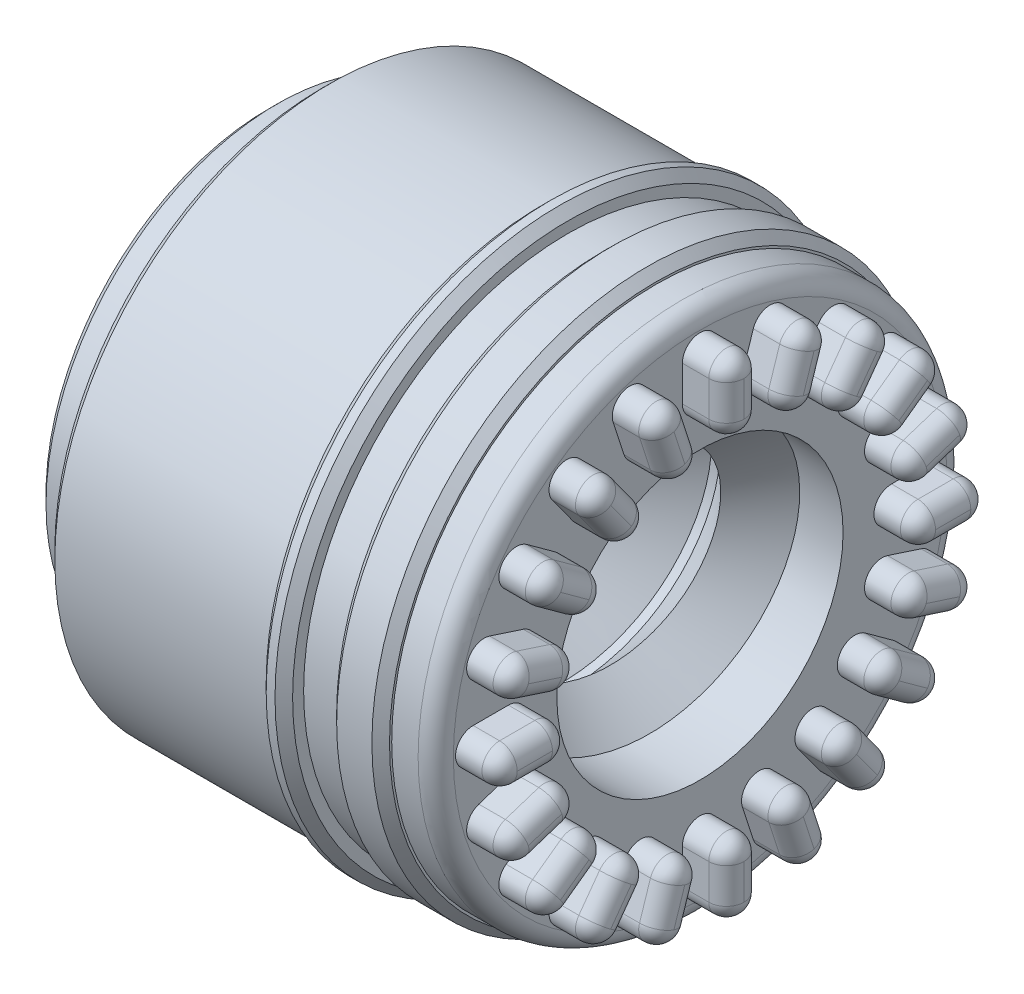
from build123d import *

# Parameters (mm, degrees)
EXTRUDE_1_DEPTH     = 1
FILLET_1_R          = 0.4
SKETCH_4_R          = 3.25
CUT_EXTRUDE_1_DEPTH = 6
FILLET_2_R          = 0.4
SWEEP_1_PITCH       = 2
SKETCH_5_R          = 0.8
SKETCH_5_R_2        = 1
CUT_EXTRUDE_2_DEPTH = 3.6
CHAMFER_1_SIZE      = 0.2
CHAMFER_2_SIZE      = 0.8


with BuildPart() as part:
    # 草图1 → 旋转1 (revolve)
    with BuildSketch(Plane.XY, mode=Mode.PRIVATE) as revolve_1_sk:
        Polygon((0, 0), (8.6, 0), (8.6, 6), (7.6, 6), (7.6, 6.25), (6.4, 6.25), (6.4, 6), (5.6, 6), (5.6, 6.45), (5.2, 6.45), (5.2, 6.25), (0, 6.25), (0, 5.25), (-1.2, 5.25), (-1.2, 2.6), (0, 2.6), align=None)
    revolve(revolve_1_sk.sketch.rotate(Axis((-19.680973305, 0, 0), (1, 0, 0)), 90), axis=Axis((-19.680973305, 0, 0), (1, 0, 0)))

    # 草图3 → 凸台-拉伸1 (add)
    with BuildSketch(Plane(origin=(8.6, 0, 0), x_dir=(0, 0, -1), z_dir=(1, 0, 0))):
        with BuildLine():
            Line((0.4, 5.15), (0.4, 4.35))
            ThreePointArc((0.4, 4.35), (0, 3.95), (-0.4, 4.35))
            Line((-0.4, 4.35), (-0.4, 5.15))
            ThreePointArc((-0.4, 5.15), (0, 5.55), (0.4, 5.15))
        make_face()
        with BuildLine():
            Line((1.971860128, 4.774334261), (1.724646532, 4.013489048))
            ThreePointArc((1.724646532, 4.013489048), (1.220617128, 3.756673239), (0.963801319, 4.260702644))
            Line((0.963801319, 4.260702644), (1.211014915, 5.021547857))
            ThreePointArc((1.211014915, 5.021547857), (1.715044319, 5.278363665), (1.971860128, 4.774334261))
        make_face()
        with BuildLine():
            Line((3.350700847, 3.93132342), (2.880472645, 3.284109825))
            ThreePointArc((2.880472645, 3.284109825), (2.321751747, 3.195617128), (2.23325905, 3.754338026))
            Line((2.23325905, 3.754338026), (2.703487252, 4.401551622))
            ThreePointArc((2.703487252, 4.401551622), (3.26220815, 4.490044319), (3.350700847, 3.93132342))
        make_face()
        with BuildLine():
            Line((4.401551622, 2.703487252), (3.754338026, 2.23325905))
            ThreePointArc((3.754338026, 2.23325905), (3.195617128, 2.321751747), (3.284109825, 2.880472645))
            Line((3.284109825, 2.880472645), (3.93132342, 3.350700847))
            ThreePointArc((3.93132342, 3.350700847), (4.490044319, 3.26220815), (4.401551622, 2.703487252))
        make_face()
        with BuildLine():
            Line((5.021547857, 1.211014915), (4.260702644, 0.963801319))
            ThreePointArc((4.260702644, 0.963801319), (3.756673239, 1.220617128), (4.013489048, 1.724646532))
            Line((4.013489048, 1.724646532), (4.774334261, 1.971860128))
            ThreePointArc((4.774334261, 1.971860128), (5.278363665, 1.715044319), (5.021547857, 1.211014915))
        make_face()
        with BuildLine():
            Line((5.15, -0.4), (4.35, -0.4))
            ThreePointArc((4.35, -0.4), (3.95, 0), (4.35, 0.4))
            Line((4.35, 0.4), (5.15, 0.4))
            ThreePointArc((5.15, 0.4), (5.55, 0), (5.15, -0.4))
        make_face()
        with BuildLine():
            Line((4.774334261, -1.971860128), (4.013489048, -1.724646532))
            ThreePointArc((4.013489048, -1.724646532), (3.756673239, -1.220617128), (4.260702644, -0.963801319))
            Line((4.260702644, -0.963801319), (5.021547857, -1.211014915))
            ThreePointArc((5.021547857, -1.211014915), (5.278363665, -1.715044319), (4.774334261, -1.971860128))
        make_face()
        with BuildLine():
            Line((3.93132342, -3.350700847), (3.284109825, -2.880472645))
            ThreePointArc((3.284109825, -2.880472645), (3.195617128, -2.321751747), (3.754338026, -2.23325905))
            Line((3.754338026, -2.23325905), (4.401551622, -2.703487252))
            ThreePointArc((4.401551622, -2.703487252), (4.490044319, -3.26220815), (3.93132342, -3.350700847))
        make_face()
        with BuildLine():
            Line((2.703487252, -4.401551622), (2.23325905, -3.754338026))
            ThreePointArc((2.23325905, -3.754338026), (2.321751747, -3.195617128), (2.880472645, -3.284109825))
            Line((2.880472645, -3.284109825), (3.350700847, -3.93132342))
            ThreePointArc((3.350700847, -3.93132342), (3.26220815, -4.490044319), (2.703487252, -4.401551622))
        make_face()
        with BuildLine():
            Line((1.211014915, -5.021547857), (0.963801319, -4.260702644))
            ThreePointArc((0.963801319, -4.260702644), (1.220617128, -3.756673239), (1.724646532, -4.013489048))
            Line((1.724646532, -4.013489048), (1.971860128, -4.774334261))
            ThreePointArc((1.971860128, -4.774334261), (1.715044319, -5.278363665), (1.211014915, -5.021547857))
        make_face()
        with BuildLine():
            Line((-0.4, -5.15), (-0.4, -4.35))
            ThreePointArc((-0.4, -4.35), (0, -3.95), (0.4, -4.35))
            Line((0.4, -4.35), (0.4, -5.15))
            ThreePointArc((0.4, -5.15), (0, -5.55), (-0.4, -5.15))
        make_face()
        with BuildLine():
            Line((-1.971860128, -4.774334261), (-1.724646532, -4.013489048))
            ThreePointArc((-1.724646532, -4.013489048), (-1.220617128, -3.756673239), (-0.963801319, -4.260702644))
            Line((-0.963801319, -4.260702644), (-1.211014915, -5.021547857))
            ThreePointArc((-1.211014915, -5.021547857), (-1.715044319, -5.278363665), (-1.971860128, -4.774334261))
        make_face()
        with BuildLine():
            Line((-3.350700847, -3.93132342), (-2.880472645, -3.284109825))
            ThreePointArc((-2.880472645, -3.284109825), (-2.321751747, -3.195617128), (-2.23325905, -3.754338026))
            Line((-2.23325905, -3.754338026), (-2.703487252, -4.401551622))
            ThreePointArc((-2.703487252, -4.401551622), (-3.26220815, -4.490044319), (-3.350700847, -3.93132342))
        make_face()
        with BuildLine():
            Line((-4.401551622, -2.703487252), (-3.754338026, -2.23325905))
            ThreePointArc((-3.754338026, -2.23325905), (-3.195617128, -2.321751747), (-3.284109825, -2.880472645))
            Line((-3.284109825, -2.880472645), (-3.93132342, -3.350700847))
            ThreePointArc((-3.93132342, -3.350700847), (-4.490044319, -3.26220815), (-4.401551622, -2.703487252))
        make_face()
        with BuildLine():
            Line((-5.021547857, -1.211014915), (-4.260702644, -0.963801319))
            ThreePointArc((-4.260702644, -0.963801319), (-3.756673239, -1.220617128), (-4.013489048, -1.724646532))
            Line((-4.013489048, -1.724646532), (-4.774334261, -1.971860128))
            ThreePointArc((-4.774334261, -1.971860128), (-5.278363665, -1.715044319), (-5.021547857, -1.211014915))
        make_face()
        with BuildLine():
            Line((-5.15, 0.4), (-4.35, 0.4))
            ThreePointArc((-4.35, 0.4), (-3.95, 0), (-4.35, -0.4))
            Line((-4.35, -0.4), (-5.15, -0.4))
            ThreePointArc((-5.15, -0.4), (-5.55, 0), (-5.15, 0.4))
        make_face()
        with BuildLine():
            Line((-4.774334261, 1.971860128), (-4.013489048, 1.724646532))
            ThreePointArc((-4.013489048, 1.724646532), (-3.756673239, 1.220617128), (-4.260702644, 0.963801319))
            Line((-4.260702644, 0.963801319), (-5.021547857, 1.211014915))
            ThreePointArc((-5.021547857, 1.211014915), (-5.278363665, 1.715044319), (-4.774334261, 1.971860128))
        make_face()
        with BuildLine():
            Line((-3.93132342, 3.350700847), (-3.284109825, 2.880472645))
            ThreePointArc((-3.284109825, 2.880472645), (-3.195617128, 2.321751747), (-3.754338026, 2.23325905))
            Line((-3.754338026, 2.23325905), (-4.401551622, 2.703487252))
            ThreePointArc((-4.401551622, 2.703487252), (-4.490044319, 3.26220815), (-3.93132342, 3.350700847))
        make_face()
        with BuildLine():
            Line((-2.703487252, 4.401551622), (-2.23325905, 3.754338026))
            ThreePointArc((-2.23325905, 3.754338026), (-2.321751747, 3.195617128), (-2.880472645, 3.284109825))
            Line((-2.880472645, 3.284109825), (-3.350700847, 3.93132342))
            ThreePointArc((-3.350700847, 3.93132342), (-3.26220815, 4.490044319), (-2.703487252, 4.401551622))
        make_face()
        with BuildLine():
            Line((-1.211014915, 5.021547857), (-0.963801319, 4.260702644))
            ThreePointArc((-0.963801319, 4.260702644), (-1.220617128, 3.756673239), (-1.724646532, 4.013489048))
            Line((-1.724646532, 4.013489048), (-1.971860128, 4.774334261))
            ThreePointArc((-1.971860128, 4.774334261), (-1.715044319, 5.278363665), (-1.211014915, 5.021547857))
        make_face()
    extrude(amount=EXTRUDE_1_DEPTH)

    # 圆角1
    fillet_1_edges = [part.edges().sort_by_distance(p)[0] for p in [
        (9.6, -1.715044319, -5.278363665),
        (9.6, -1.087408117, -4.64112525),
        (9.6, -1.220617128, -3.756673239),
        (9.6, -1.84825333, -4.393911655),
        (9.6, -3.26220815, -4.490044319),
        (9.6, -2.468373151, -4.077944824),
        (9.6, -2.321751747, -3.195617128),
        (9.6, -3.115586746, -3.607716622),
        (9.6, -4.490044319, -3.26220815),
        (9.6, -3.607716622, -3.115586746),
        (9.6, -3.195617128, -2.321751747),
        (9.6, -4.077944824, -2.468373151),
        (9.6, -5.278363665, -1.715044319),
        (9.6, -4.393911655, -1.84825333),
        (9.6, -3.756673239, -1.220617128),
        (9.6, -4.64112525, -1.087408117),
        (9.6, -5.55, 0),
        (9.6, -4.75, -0.4),
        (9.6, -3.95, 0),
        (9.6, -4.75, 0.4),
        (9.6, -5.278363665, 1.715044319),
        (9.6, -4.64112525, 1.087408117),
        (9.6, -3.756673239, 1.220617128),
        (9.6, -4.393911655, 1.84825333),
        (9.6, -4.490044319, 3.26220815),
        (9.6, -4.077944824, 2.468373151),
        (9.6, -3.195617128, 2.321751747),
        (9.6, -3.607716622, 3.115586746),
        (9.6, -3.26220815, 4.490044319),
        (9.6, -3.115586746, 3.607716622),
        (9.6, -2.321751747, 3.195617128),
        (9.6, -2.468373151, 4.077944824),
        (9.6, -1.715044319, 5.278363665),
        (9.6, -1.84825333, 4.393911655),
        (9.6, -1.220617128, 3.756673239),
        (9.6, -1.087408117, 4.64112525),
        (9.6, 0, 5.55),
        (9.6, -0.4, 4.75),
        (9.6, 0, 3.95),
        (9.6, 0.4, 4.75),
        (9.6, 1.715044319, 5.278363665),
        (9.6, 1.087408117, 4.64112525),
        (9.6, 1.220617128, 3.756673239),
        (9.6, 1.84825333, 4.393911655),
        (9.6, 3.26220815, 4.490044319),
        (9.6, 2.468373151, 4.077944824),
        (9.6, 2.321751747, 3.195617128),
        (9.6, 3.115586746, 3.607716622),
        (9.6, 4.490044319, 3.26220815),
        (9.6, 3.607716622, 3.115586746),
        (9.6, 3.195617128, 2.321751747),
        (9.6, 4.077944824, 2.468373151),
        (9.6, 5.278363665, 1.715044319),
        (9.6, 4.393911655, 1.84825333),
        (9.6, 3.756673239, 1.220617128),
        (9.6, 4.64112525, 1.087408117),
        (9.6, 5.55, 0),
        (9.6, 4.75, 0.4),
        (9.6, 3.95, 0),
        (9.6, 4.75, -0.4),
        (9.6, 5.278363665, -1.715044319),
        (9.6, 4.64112525, -1.087408117),
        (9.6, 3.756673239, -1.220617128),
        (9.6, 4.393911655, -1.84825333),
        (9.6, 4.490044319, -3.26220815),
        (9.6, 4.077944824, -2.468373151),
        (9.6, 3.195617128, -2.321751747),
        (9.6, 3.607716622, -3.115586746),
        (9.6, 3.26220815, -4.490044319),
        (9.6, 3.115586746, -3.607716622),
        (9.6, 2.321751747, -3.195617128),
        (9.6, 2.468373151, -4.077944824),
        (9.6, 1.715044319, -5.278363665),
        (9.6, 1.84825333, -4.393911655),
        (9.6, 1.220617128, -3.756673239),
        (9.6, 1.087408117, -4.64112525),
        (9.6, 0, -5.55),
        (9.6, 0.4, -4.75),
        (9.6, 0, -3.95),
        (9.6, -0.4, -4.75),
    ]]
    fillet(fillet_1_edges, radius=FILLET_1_R - 0.0001)  # a hair under: the kernel refuses the full size

    # 草图4 → 切除-拉伸1 (cut)
    with BuildSketch(Plane(origin=(8.6, 0, 0), x_dir=(0, 0, -1), z_dir=(1, 0, 0))):
        Circle(SKETCH_4_R)
    extrude(amount=-CUT_EXTRUDE_1_DEPTH, mode=Mode.SUBTRACT)

    # 圆角2
    fillet_2_edges = [part.edges().sort_by_distance(p)[0] for p in [
        (8.6, 0, -6),
    ]]
    fillet(fillet_2_edges, radius=FILLET_2_R)

    # 扫描1: the profile of 草图7 profile screwed along a right-hand helix of 3 turns, 10 arcs to a turn; built about Z, then put on its axis
    sweep_1_z = Axis((0, 0, 0), (0, 0, 1))
    sweep_1_corners = [(3.2503, 0, -0.0003), (3.2503, 0, 1.8003), (2.35, 0, 0.9)]
    with BuildLine(mode=Mode.PRIVATE) as sweep_1_profile:
        Line(sweep_1_corners[0], sweep_1_corners[1])
        Line(sweep_1_corners[1], sweep_1_corners[2])
        Line(sweep_1_corners[2], sweep_1_corners[0])
    sweep_1_cap = Face(sweep_1_profile.wire())
    sweep_1_turn_angles = [0, 18, 36, 54, 72, 90, 108, 126, 144, 162, 180, 198, 216, 234, 252, 270, 288, 306, 324, 342, 360]
    sweep_1_turn_weights = [1, 0.9510565162951535, 1, 0.9510565162951535, 1, 0.9510565162951535, 1, 0.9510565162951535, 1, 0.9510565162951535, 1, 0.9510565162951535, 1, 0.9510565162951535, 1, 0.9510565162951535, 1, 0.9510565162951535, 1, 0.9510565162951535, 1]
    sweep_1_turn_rails = [Edge.make_bspline([Vector(p[0], p[1], 0).rotate(sweep_1_z, sweep_1_turn_angles[k]) / sweep_1_turn_weights[k] + Vector(0, 0, p[2] + SWEEP_1_PITCH * sweep_1_turn_angles[k] / 360) for k in range(21)], [0, 0, 0, 1, 1, 2, 2, 3, 3, 4, 4, 5, 5, 6, 6, 7, 7, 8, 8, 9, 9, 10, 10, 10], 2, sweep_1_turn_weights) for p in sweep_1_corners]
    sweep_1_turn_sides = [Face.make_surface_from_curves(sweep_1_turn_rails[p[0]], sweep_1_turn_rails[p[1]]) for p in [(0, 1), (1, 2), (2, 0)]]
    sweep_1 = Plane(origin=(8.6, 0, 0), x_dir=(0, 0, 1), z_dir=(-1, 0, 0)) * Solid(Shell([*[p.moved(Location((0, 0, SWEEP_1_PITCH * i))) for i in range(3) for p in sweep_1_turn_sides], sweep_1_cap, sweep_1_cap.rotate(sweep_1_z, 1080).moved(Location((0, 0, SWEEP_1_PITCH * 1080 / 360)))]))
    add(sweep_1)

    # 草图5 → 切除-拉伸2 (cut)
    with BuildSketch(Plane.ZY.offset(1.2)):
        with Locations((0, 3.9)):
            Circle(SKETCH_5_R)
        with Locations((3.9, 0)):
            Circle(SKETCH_5_R)
        with Locations((0, -3.9)):
            Circle(SKETCH_5_R)
        with Locations((-3.9, 0)):
            Circle(SKETCH_5_R)
        with Locations((2.757716447, -2.757716447)):
            Circle(SKETCH_5_R_2)
    extrude(amount=-CUT_EXTRUDE_2_DEPTH, mode=Mode.SUBTRACT)

    # 倒角1
    chamfer_1_edges = [part.edges().sort_by_distance(p)[0] for p in [
        (-1.2, 0, -2.6),
        (7.6, 0, -6.25),
        (6.4, 0, -6.25),
        (5.6, 0, -6.45),
        (5.2, 0, -6.25),
        (0, 0, -6.25),
        (-1.2, 0, -5.25),
    ]]
    chamfer(chamfer_1_edges, length=CHAMFER_1_SIZE - 0.0001)  # a hair under: the kernel refuses the full size

    # 倒角2
    chamfer_2_edges = [part.edges().sort_by_distance(p)[0] for p in [
        (2.4, 3.9, -0.8),
        (2.4, -2.757716447, 1.757716447),
        (2.4, 0, 3.1),
        (2.4, -3.9, -0.8),
        (2.4, 0, -4.7),
    ]]
    chamfer(chamfer_2_edges, length=CHAMFER_2_SIZE - 0.0001)  # a hair under: the kernel refuses the full size


solid = part.part
